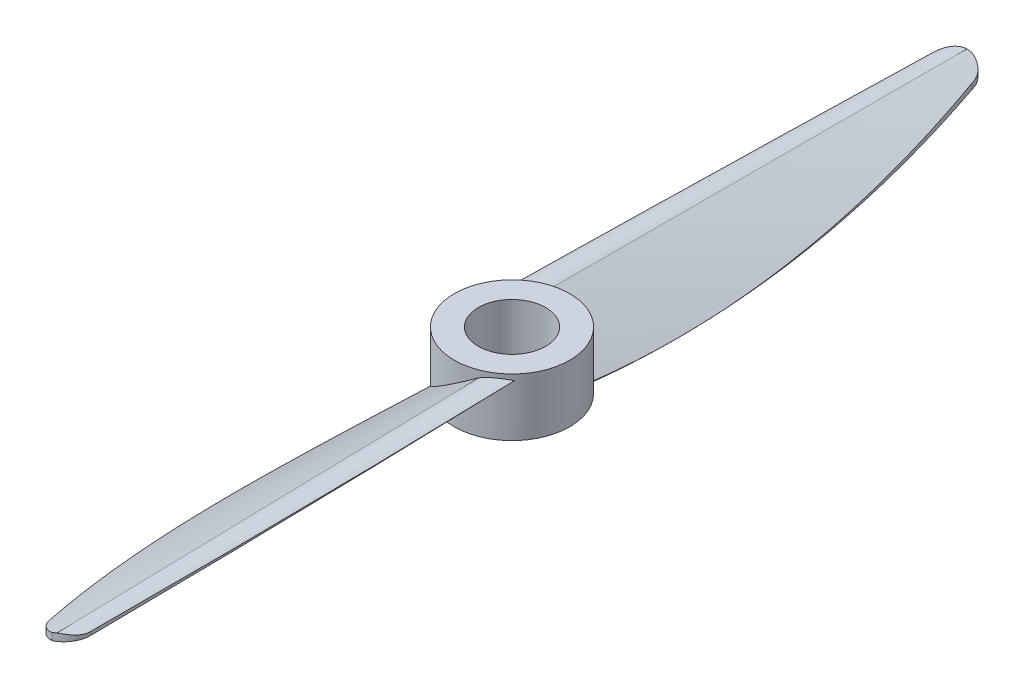
from build123d import *

# Parameters (mm, degrees)
SKETCH_1_R               = 6
SKETCH_1_R_2             = 3.5
EXTRUDE_1_DEPTH          = 6
CUT_EXTRUDE_1_DEPTH      = 51.714889455
PATTERN_CIRCULAR_1_COUNT = 2
SKETCH_6_R               = 3.500000001
CUT_EXTRUDE_2_DEPTH      = 51.714889443


with BuildPart() as part:
    # 草图1 → 凸台-拉伸1 (new body)
    with BuildSketch(Plane(origin=(0, 0, 0), x_dir=(1, 0, 0), z_dir=(0, 1, 0))):
        with Locations(Location((0, 0, 0), (0, 0, 270))):
            Circle(SKETCH_1_R)
        with Locations(Location((0, 0, 0), (0, 0, 270))):
            Circle(SKETCH_1_R_2, mode=Mode.SUBTRACT)
    extrude(amount=EXTRUDE_1_DEPTH)

    # 放样1: read off the stored shape, not the designer's step
    # 放样1: loft between two sections, ruled curve by curve
    loft_1_from = [
        Edge.make_bspline([(4.829629131, 4.294095226, 50), (4.661491838, 4.287956363, 50), (4.325526719, 4.26719033, 50), (3.823791731, 4.210654383, 50), (3.325552775, 4.128877425, 50), (2.996563694, 4.057669381, 50), (2.187142745, 3.850933665, 50), (0.89862524, 3.503994998, 50), (-1.023348969, 2.94500881, 50), (-2.933748014, 2.347669617, 50), (-4.199124361, 1.92403297, 50), (-4.829629131, 1.705904774, 50)], [0, 0, 0, 0, 0.050348748, 0.100697496, 0.151046245, 0.201394993, 0.201394993, 0.401046245, 0.600697496, 0.800348748, 1, 1, 1, 1], 3),
        Edge.make_bspline([(2.638958434, 4.742382962, 50), (3.399643135, 4.880839784, 50), (4.184480539, 4.72023464, 50), (4.829629131, 4.294095226, 50)], [0, 0, 0, 0, 1, 1, 1, 1], 3),
        Edge.make_bspline([(-4.829629131, 1.705904774, 50), (-2.410341267, 2.884687308, 50), (0.08347511, 3.898589732, 50), (2.638958434, 4.742382962, 50)], [0, 0, 0, 0, 1, 1, 1, 1], 3),
    ]
    loft_1_to = [
        Edge.make_bspline([(4.330127019, 5.5, 0), (4.16930772, 5.450553181, 0), (3.850164979, 5.343540561, 0), (3.380158776, 5.15907246, 0), (2.920062334, 4.951128253, 0), (2.620713283, 4.797197925, 0), (1.892379824, 4.388013, 0), (0.737561824, 3.719403112, 0), (-0.974246431, 2.682020387, 0), (-2.664947447, 1.610587376, 0), (-3.777561909, 0.873882301, 0), (-4.330127019, 0.5, 0)], [0, 0, 0, 0, 0.050348748, 0.100697496, 0.151046245, 0.201394993, 0.201394993, 0.401046245, 0.600697496, 0.800348748, 1, 1, 1, 1], 3),
        Edge.make_bspline([(2.098076211, 5.366025404, 0), (2.797005947, 5.696644113, 0), (3.596668336, 5.744642324, 0), (4.330127019, 5.5, 0)], [0, 0, 0, 0, 1, 1, 1, 1], 3),
        Edge.make_bspline([(-4.330127019, 0.5, 0), (-2.298365759, 2.264774268, 0), (-0.151941372, 3.889575977, 0), (2.098076211, 5.366025404, 0)], [0, 0, 0, 0, 1, 1, 1, 1], 3),
    ]
    loft_1 = Solid(Shell([*[Face.make_surface_from_curves(loft_1_from[k], loft_1_to[k]) for k in range(3)], Face(Wire(loft_1_from)), Face(Wire(loft_1_to))]))
    add(loft_1)

    # Loft 1 2: loft between two sections, ruled curve by curve
    loft_1_2_from = [
        Edge.make_bspline([(4.829629131, 4.294095226, 50), (4.661491838, 4.287956363, 50), (4.325526719, 4.26719033, 50), (3.823791731, 4.210654383, 50), (3.325552775, 4.128877425, 50), (2.996563694, 4.057669381, 50), (2.187142745, 3.850933665, 50), (0.89862524, 3.503994998, 50), (-1.023348969, 2.94500881, 50), (-2.933748014, 2.347669617, 50), (-4.199124361, 1.92403297, 50), (-4.829629131, 1.705904774, 50)], [0, 0, 0, 0, 0.050348748, 0.100697496, 0.151046245, 0.201394993, 0.201394993, 0.401046245, 0.600697496, 0.800348748, 1, 1, 1, 1], 3),
        Edge.make_bspline([(-4.829629131, 1.705904774, 50), (-2.410341267, 2.884687308, 50), (0.08347511, 3.898589732, 50), (2.638958434, 4.742382962, 50)], [0, 0, 0, 0, 1, 1, 1, 1], 3),
        Edge.make_bspline([(2.638958434, 4.742382962, 50), (3.399643135, 4.880839784, 50), (4.184480539, 4.72023464, 50), (4.829629131, 4.294095226, 50)], [0, 0, 0, 0, 1, 1, 1, 1], 3),
    ]
    loft_1_2_to = [
        Edge.make_bspline([(4.330127019, 5.5, 0), (4.16930772, 5.450553181, 0), (3.850164979, 5.343540561, 0), (3.380158776, 5.15907246, 0), (2.920062334, 4.951128253, 0), (2.620713283, 4.797197925, 0), (1.892379824, 4.388013, 0), (0.737561824, 3.719403112, 0), (-0.974246431, 2.682020387, 0), (-2.664947447, 1.610587376, 0), (-3.777561909, 0.873882301, 0), (-4.330127019, 0.5, 0)], [0, 0, 0, 0, 0.050348748, 0.100697496, 0.151046245, 0.201394993, 0.201394993, 0.401046245, 0.600697496, 0.800348748, 1, 1, 1, 1], 3),
        Edge.make_bspline([(-4.330127019, 0.5, 0), (-2.298365759, 2.264774268, 0), (-0.151941372, 3.889575977, 0), (2.098076211, 5.366025404, 0)], [0, 0, 0, 0, 1, 1, 1, 1], 3),
        Edge.make_bspline([(2.098076211, 5.366025404, 0), (2.797005947, 5.696644113, 0), (3.596668336, 5.744642324, 0), (4.330127019, 5.5, 0)], [0, 0, 0, 0, 1, 1, 1, 1], 3),
    ]
    loft_1_2 = Solid(Shell([*[Face.make_surface_from_curves(loft_1_2_from[k], loft_1_2_to[k]) for k in range(3)], Face(Wire(loft_1_2_from)), Face(Wire(loft_1_2_to))]))
    add(loft_1_2)

    # 草图5 → 切除-拉伸1 (cut, through all)
    with BuildSketch(Plane(origin=(0, 0, 0), x_dir=(1, 0, 0), z_dir=(0, 1, 0))):
        with BuildLine():
            Line((-4.371186853, -4.110076094), (-6.947319176, -4.110076094))
            Line((-6.947319176, -4.110076094), (-6.947319176, -57.52702734))
            Line((-6.947319176, -57.52702734), (10.303651078, -57.52702734))
            Line((10.303651078, -57.52702734), (10.303651078, -4.110076094))
            Line((10.303651078, -4.110076094), (4.371186853, -4.110076094))
            ThreePointArc((4.371186853, -4.110076094), (4.391179084, -26.055588932), (4.170370869, -48))
            ThreePointArc((4.170370869, -48), (3.584584431, -49.414213562), (2.170370869, -50))
            ThreePointArc((2.170370869, -50), (0.860341889, -49.310028979), (0.170370869, -48))
            ThreePointArc((0.170370869, -48), (-3.914204719, -26.427627996), (-4, -4.472135955))
            ThreePointArc((-4, -4.472135955), (-4.189506435, -4.295117674), (-4.371186853, -4.110076094))
        make_face()
    cut_extrude_1 = extrude(amount=CUT_EXTRUDE_1_DEPTH, mode=Mode.SUBTRACT)

    # 阵列(圆周)1: 放样1, Loft 1 2, 切除-拉伸1 ×2 about axis
    pattern_circular_1_axis = Axis((0, 6, 0), (0, -1, 0))
    add([loft_1.rotate(pattern_circular_1_axis, i * 360 / PATTERN_CIRCULAR_1_COUNT) for i in range(1, PATTERN_CIRCULAR_1_COUNT)])
    add([loft_1_2.rotate(pattern_circular_1_axis, i * 360 / PATTERN_CIRCULAR_1_COUNT) for i in range(1, PATTERN_CIRCULAR_1_COUNT)])
    add([cut_extrude_1.rotate(pattern_circular_1_axis, i * 360 / PATTERN_CIRCULAR_1_COUNT) for i in range(1, PATTERN_CIRCULAR_1_COUNT)], mode=Mode.SUBTRACT)

    # 草图6 → 切除-拉伸2 (cut, through all)
    with BuildSketch(Plane(origin=(0, 6, 0), x_dir=(1, 0, 0), z_dir=(0, 1, 0))):
        with Locations(Location((1e-09, 0, 0), (0, 0, 269.999999987))):
            Circle(SKETCH_6_R)
    extrude(amount=-CUT_EXTRUDE_2_DEPTH, mode=Mode.SUBTRACT)


solid = part.part
